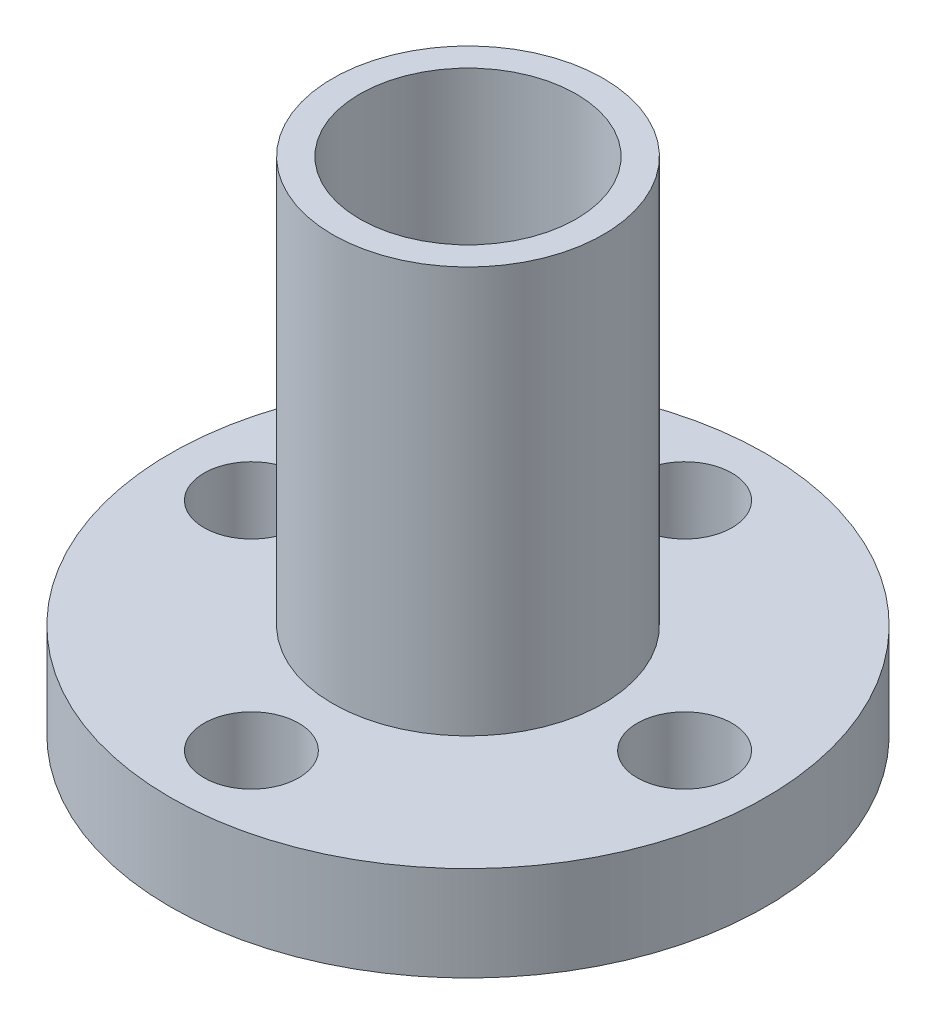
from build123d import *

# Parameters (mm, degrees)
SKETCH_1_R           = 11
EXTRUDE_1_DEPTH      = 3.5
EXTRUDE_2_DEPTH      = 15
EXTRUDE_2_DEPTH_BACK = 5.5
SKETCH_2_R           = 5
SKETCH_2_R_2         = 4
SKETCH_3_R           = 4
SKETCH_3_R_2         = 1.75
CUT_EXTRUDE_1_DEPTH  = 22.610182785


with BuildPart() as part:
    # 草图1 → 凸台-拉伸1 (new body)
    with BuildSketch(Plane.XZ.offset(-1.5)):
        Circle(SKETCH_1_R)
    extrude(amount=-EXTRUDE_1_DEPTH)

    # 草图2 → 凸台-拉伸2 (add, two sides: drawn at the far end of the back side and taken through both)
    with BuildSketch(Plane(origin=(0, 5, 0), x_dir=(1, 0, 0), z_dir=(0, 1, 0)).offset(-EXTRUDE_2_DEPTH_BACK)):
        Circle(SKETCH_2_R)
        Circle(SKETCH_2_R_2, mode=Mode.SUBTRACT)
    extrude(amount=EXTRUDE_2_DEPTH + EXTRUDE_2_DEPTH_BACK)

    # 草图3 → 切除-拉伸1 (cut, through all)
    with BuildSketch(Plane(origin=(0, 5, 0), x_dir=(1, 0, 0), z_dir=(0, 1, 0))):
        Circle(SKETCH_3_R)
        with Locations((-8, 0)):
            Circle(SKETCH_3_R_2)
        with Locations((0, 8)):
            Circle(SKETCH_3_R_2)
        with Locations((8, 0)):
            Circle(SKETCH_3_R_2)
        with Locations((0, -8)):
            Circle(SKETCH_3_R_2)
    extrude(amount=-CUT_EXTRUDE_1_DEPTH, mode=Mode.SUBTRACT)


solid = part.part
